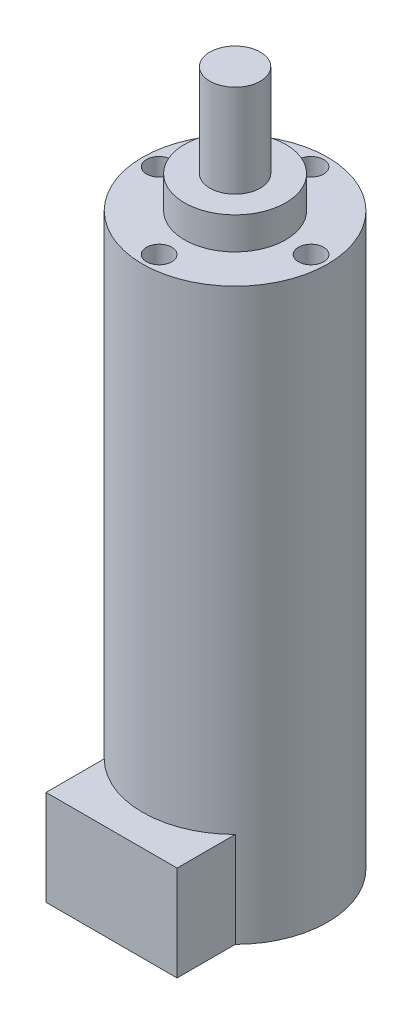
from build123d import *

# Parameters (mm, degrees)
SKETCH1_R           = 10.9855
BOSS_EXTRUDE1_DEPTH = 33.8328
SKETCH2_R           = 6.0071
BOSS_EXTRUDE2_DEPTH = 3.81
SKETCH3_R           = 2.9972
BOSS_EXTRUDE3_DEPTH = 10.9982
SKETCH5_R           = 1.5
CUT_EXTRUDE1_DEPTH  = 7.62
CIRPATTERN1_COUNT   = 4
BOSS_EXTRUDE4_START = -11.303
BOSS_EXTRUDE4_DEPTH = 11.303


with BuildPart() as part:
    # Sketch1 → Boss-Extrude1 (new, symmetric)
    with BuildSketch(Plane(origin=(0, 0, 0), x_dir=(1, 0, 0), z_dir=(0, 1, 0))):
        Circle(SKETCH1_R)
    extrude(amount=BOSS_EXTRUDE1_DEPTH, both=True)

    # Sketch2 → Boss-Extrude2 (add)
    with BuildSketch(Plane(origin=(0, 33.8328, 0), x_dir=(1, 0, 0), z_dir=(0, 1, 0))):
        Circle(SKETCH2_R)
    extrude(amount=BOSS_EXTRUDE2_DEPTH)

    # Sketch3 → Boss-Extrude3 (add)
    with BuildSketch(Plane(origin=(0, 37.6428, 0), x_dir=(1, 0, 0), z_dir=(0, 1, 0))):
        Circle(SKETCH3_R)
    extrude(amount=BOSS_EXTRUDE3_DEPTH)

    # Sketch5 → Cut-Extrude1 (cut)
    with BuildSketch(Plane(origin=(0, 33.8328, 0), x_dir=(1, 0, 0), z_dir=(0, 1, 0))):
        with Locations((0, 9.017)):
            Circle(SKETCH5_R)
    cut_extrude1 = extrude(amount=-CUT_EXTRUDE1_DEPTH, mode=Mode.SUBTRACT)

    # CirPattern1: Cut-Extrude1 ×4 about axis
    cirpattern1_axis = Axis((0, 33.8328, 0), (0, 1, 0))
    for i in range(1, CIRPATTERN1_COUNT):
        add(cut_extrude1.rotate(cirpattern1_axis, i * 360 / CIRPATTERN1_COUNT), mode=Mode.SUBTRACT)

    # Sketch6 → Boss-Extrude4 (add)
    with BuildSketch(Plane(origin=(0, -33.8328, 0), x_dir=(-1, 0, 0), z_dir=(0, -1, 0)).offset(BOSS_EXTRUDE4_START)):
        with BuildLine():
            Line((7.777611481, -14.664795479), (7.777611481, -7.758219506))
            ThreePointArc((7.777611481, -7.758219506), (0, -10.9855), (-7.777611481, -7.758219506))
            Line((-7.777611481, -7.758219506), (-7.777611481, -14.664795479))
            Line((-7.777611481, -14.664795479), (7.777611481, -14.664795479))
        make_face()
    extrude(amount=BOSS_EXTRUDE4_DEPTH)


solid = part.part
